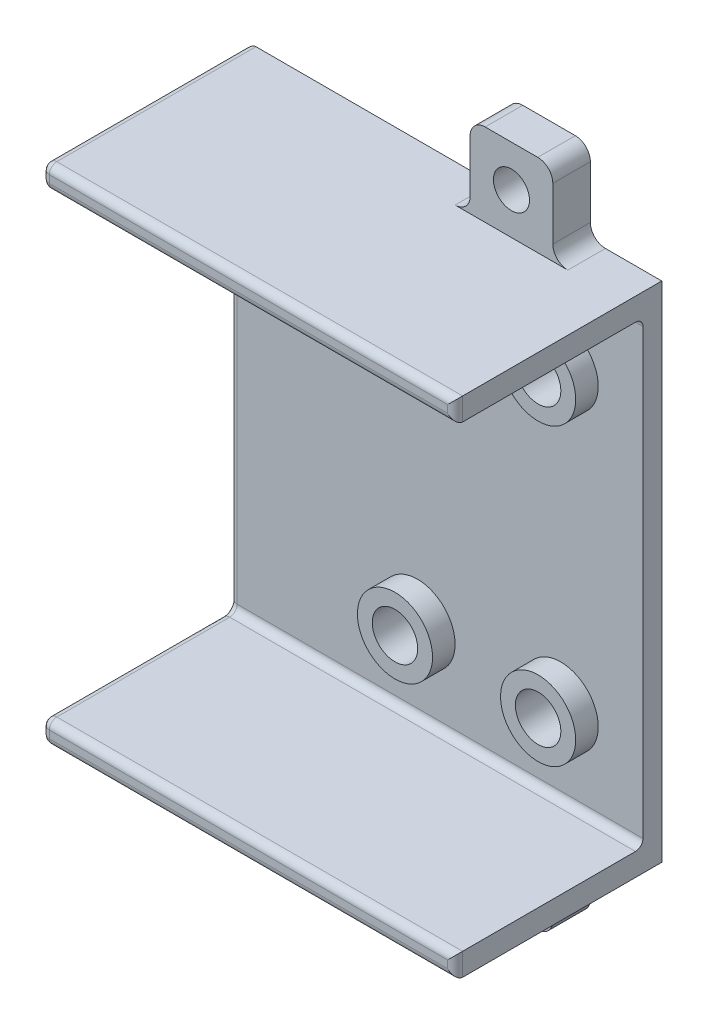
from build123d import *

# Parameters (mm, degrees)
SKETCH1_W            = 55
SKETCH1_H            = 67
BOSS_EXTRUDE1_DEPTH  = 2.5
SKETCH2_W            = 55
SKETCH2_H            = 3
BOSS_EXTRUDE2_DEPTH  = 25
SKETCH3_R            = 5
SKETCH3_R_2          = 3.025
BOSS_EXTRUDE3_DEPTH  = 3
CUT_EXTRUDE1_START   = -2
SKETCH4_R            = 3.025
CUT_EXTRUDE1_DEPTH   = 2
SKETCH5_W            = 11
SKETCH5_H            = 11
BOSS_EXTRUDE4_DEPTH  = 5
M4_CLEARANCE_HOLE1_D = 4.8
FILLET3_R            = 2
FILLET4_R            = 1


with BuildPart() as part:
    # Sketch1 → Boss-Extrude1 (new body)
    with BuildSketch(Plane.XY):
        Rectangle(SKETCH1_W, SKETCH1_H)
    extrude(amount=BOSS_EXTRUDE1_DEPTH)

    # Sketch2 → Boss-Extrude2 (add)
    with BuildSketch(Plane.XY.offset(2.5)):
        with Locations((0, 32)):
            Rectangle(SKETCH2_W, SKETCH2_H)
        with Locations((0, -32)):
            Rectangle(SKETCH2_W, SKETCH2_H)
    extrude(amount=BOSS_EXTRUDE2_DEPTH)

    # Sketch3 → Boss-Extrude3 (add)
    # profile 1 of 4: a face of its own
    with BuildSketch(Plane.XY.offset(2.5)):
        with Locations((-2.504, 19.6215)):
            Circle(SKETCH3_R)
        with Locations((-2.504, 19.6215)):
            Circle(SKETCH3_R_2, mode=Mode.SUBTRACT)
    # profile 2 of 4: a face of its own
    with BuildSketch(Plane.XY.offset(2.5)):
        with Locations((16.546, 19.6215)):
            Circle(SKETCH3_R)
        with Locations((16.546, 19.6215)):
            Circle(SKETCH3_R_2, mode=Mode.SUBTRACT)
    # profile 3 of 4: a face of its own
    with BuildSketch(Plane.XY.offset(2.5)):
        with Locations((16.546, -19.6215)):
            Circle(SKETCH3_R)
        with Locations((16.546, -19.6215)):
            Circle(SKETCH3_R_2, mode=Mode.SUBTRACT)
    # profile 4 of 4: a face of its own
    with BuildSketch(Plane.XY.offset(2.5)):
        with Locations((-2.504, -19.6215)):
            Circle(SKETCH3_R)
        with Locations((-2.504, -19.6215)):
            Circle(SKETCH3_R_2, mode=Mode.SUBTRACT)
    extrude(amount=BOSS_EXTRUDE3_DEPTH)

    # Sketch4 → Cut-Extrude1 (cut)
    with BuildSketch(Plane.XY.offset(2.5).offset(CUT_EXTRUDE1_START)):
        with Locations((16.546, -19.6215)):
            Circle(SKETCH4_R)
        with Locations((-2.504, -19.6215)):
            Circle(SKETCH4_R)
        with Locations((16.546, 19.6215)):
            Circle(SKETCH4_R)
        with Locations((-2.504, 19.6215)):
            Circle(SKETCH4_R)
    extrude(amount=CUT_EXTRUDE1_DEPTH, mode=Mode.SUBTRACT)

    # Sketch5 → Boss-Extrude4 (add)
    with BuildSketch(Plane(origin=(0, 0, 0), x_dir=(-1, 0, 0), z_dir=(0, 0, -1))):
        with Locations((-12.5, 39)):
            Rectangle(SKETCH5_W, SKETCH5_H)
    boss_extrude4 = extrude(amount=-BOSS_EXTRUDE4_DEPTH)

    # M4 Clearance Hole1 (through all)
    with Locations(Plane.XY.offset(5)):
        with Locations((12.5, 39)):
            m4_clearance_hole1 = Hole(M4_CLEARANCE_HOLE1_D / 2)

    # Mirror2: Boss-Extrude4, M4 Clearance Hole1 across plane
    add(boss_extrude4.mirror(Plane.ZX))
    add(m4_clearance_hole1.mirror(Plane.ZX), mode=Mode.SUBTRACT)

    # Fillet3
    fillet3_edges = [part.edges().sort_by_distance(p)[0] for p in [
        (18, -33.5, 2.5),
        (18, -44.5, 2.5),
        (7, -44.5, 2.5),
        (7, -33.5, 2.5),
        (18, 33.5, 2.5),
        (18, 44.5, 2.5),
        (7, 44.5, 2.5),
        (7, 33.5, 2.5),
    ]]
    fillet(fillet3_edges, radius=FILLET3_R)

    # Fillet4
    fillet4_edges = [part.edges().sort_by_distance(p)[0] for p in [
        (0, 33.5, 27.5),
        (27.5, 32, 27.5),
        (0, 30.5, 27.5),
        (-27.5, 32, 27.5),
        (0, -33.5, 27.5),
        (-27.5, -32, 27.5),
        (0, -30.5, 27.5),
        (27.5, -32, 27.5),
        (0, 30.5, 2.5),
        (0, -30.5, 2.5),
        (-27.5, 33.5, 13.75),
        (-27.5, 30.5, 15),
        (-27.5, 0, 2.5),
        (-27.5, -30.5, 15),
        (-27.5, -33.5, 13.75),
        (-27.5, 0, 0),
    ]]
    fillet(fillet4_edges, radius=FILLET4_R)


solid = part.part
